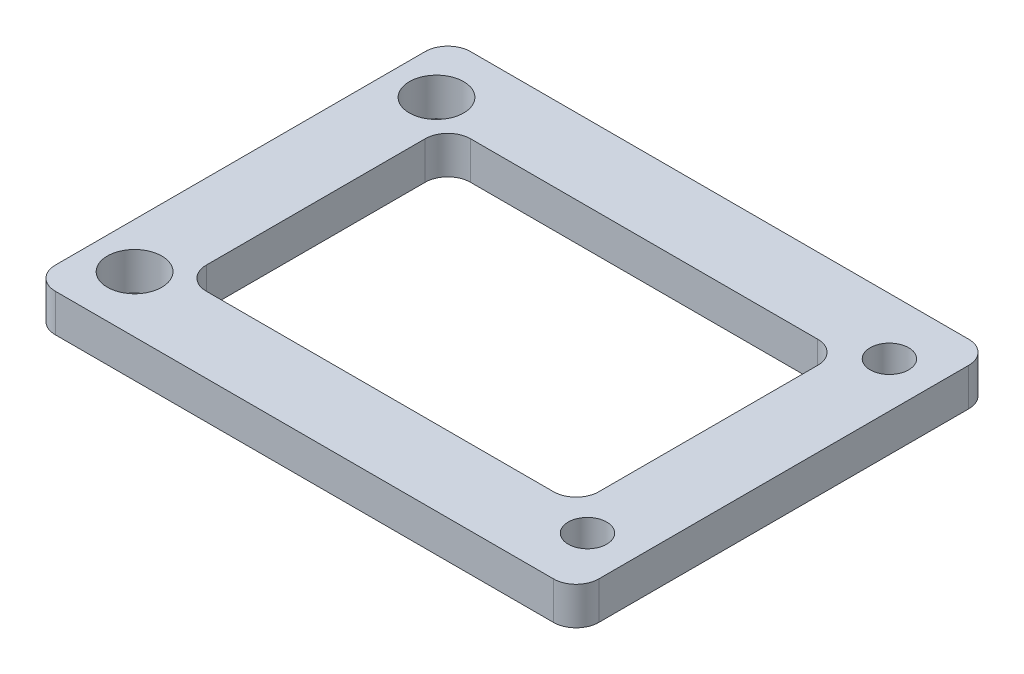
from build123d import *

# Parameters (mm, degrees)
SKETCH1_R                                  = 3.6
SKETCH1_R_2                                = 2.55
BOSS_EXTRUDE1_DEPTH                        = 5
SKETCH3_W                                  = 72
SKETCH3_H                                  = 55
SKETCH3_R                                  = 2.55
SKETCH3_R_2                                = 3.6
SKETCH3_W_2                                = 52
SKETCH3_H_2                                = 35
BOSS_EXTRUDE2_DEPTH                        = 5
SKETCH4_W                                  = 52
SKETCH4_H                                  = 35
CUT_EXTRUDE1_DEPTH                         = 5
MIRROR1_AT_THE_SECOND_PLANE_COPY_1_SKETC_W = 52
MIRROR1_AT_THE_SECOND_PLANE_COPY_1_SKETC_H = 35
MIRROR1_AT_THE_SECOND_PLANE_COPY_1_DEPTH   = 5
FILLET1_R                                  = 3


with BuildPart() as part:
    # Sketch1 → Boss-Extrude1 (new body)
    with BuildSketch(Plane(origin=(0, 0, 0), x_dir=(1, 0, 0), z_dir=(0, 1, 0))):
        with BuildLine():
            ThreePointArc((-26.117098626, 25.82435206), (-35.82435206, 23.882901374), (-33.882901374, 14.17564794))
            Line((-33.882901374, 14.17564794), (-12.619429464, 0))
            Line((-12.619429464, 0), (-33.882901374, -14.17564794))
            ThreePointArc((-33.882901374, -14.17564794), (-35.82435206, -23.882901374), (-26.117098626, -25.82435206))
            Line((-26.117098626, -25.82435206), (0, -8.412952976))
            Line((0, -8.412952976), (26.117098626, -25.82435206))
            ThreePointArc((26.117098626, -25.82435206), (35.82435206, -23.882901374), (33.882901374, -14.17564794))
            Line((33.882901374, -14.17564794), (12.619429464, 0))
            Line((12.619429464, 0), (33.882901374, 14.17564794))
            ThreePointArc((33.882901374, 14.17564794), (35.82435206, 23.882901374), (26.117098626, 25.82435206))
            Line((26.117098626, 25.82435206), (0, 8.412952976))
            Line((0, 8.412952976), (-26.117098626, 25.82435206))
        make_face()
        with Locations((-30, -20)):
            Circle(SKETCH1_R, mode=Mode.SUBTRACT)
        with Locations((30, -20)):
            Circle(SKETCH1_R_2, mode=Mode.SUBTRACT)
        with Locations((-30, 20)):
            Circle(SKETCH1_R, mode=Mode.SUBTRACT)
        with Locations((30, 20)):
            Circle(SKETCH1_R_2, mode=Mode.SUBTRACT)
    extrude(amount=BOSS_EXTRUDE1_DEPTH)

    # Sketch3 → Boss-Extrude2 (add)
    with BuildSketch(Plane.XZ):
        Rectangle(SKETCH3_W, SKETCH3_H)
        with Locations((30, 20)):
            Circle(SKETCH3_R, mode=Mode.SUBTRACT)
        with Locations((30, -20)):
            Circle(SKETCH3_R, mode=Mode.SUBTRACT)
        with Locations((-30, -20)):
            Circle(SKETCH3_R_2, mode=Mode.SUBTRACT)
        with Locations((-30, 20)):
            Circle(SKETCH3_R_2, mode=Mode.SUBTRACT)
        Rectangle(SKETCH3_W_2, SKETCH3_H_2, mode=Mode.SUBTRACT)
    extrude(amount=-BOSS_EXTRUDE2_DEPTH)

    # Sketch4 → Cut-Extrude1 (cut)
    with BuildSketch(Plane.XZ):
        Rectangle(SKETCH4_W, SKETCH4_H)
        with BuildLine():
            Line((-36, 23.605551275), (-36, 16.394448725))
            ThreePointArc((-36, 16.394448725), (-37, 20), (-36, 23.605551275))
        make_face()
    cut_extrude1 = extrude(amount=-CUT_EXTRUDE1_DEPTH, mode=Mode.SUBTRACT)

    # Mirror1: Cut-Extrude1 across plane
    add(cut_extrude1.mirror(Plane(origin=(0, 0, 0), x_dir=(0, 0, 1), z_dir=(1, 0, 0))), mode=Mode.SUBTRACT)

    # Mirror1 at the second plane: Cut-Extrude1 across plane
    add(cut_extrude1.mirror(Plane.XY), mode=Mode.SUBTRACT)

    # Mirror1 at the second plane copy 1 sketc → Mirror1 at the second plane copy 1 (cut)
    with BuildSketch(Plane(origin=(0, 0, 0), x_dir=(-1, 0, 0), z_dir=(0, -1, 0))):
        Rectangle(MIRROR1_AT_THE_SECOND_PLANE_COPY_1_SKETC_W, MIRROR1_AT_THE_SECOND_PLANE_COPY_1_SKETC_H)
        with BuildLine():
            Line((-36, 23.605551275), (-36, 16.394448725))
            ThreePointArc((-36, 16.394448725), (-37, 20), (-36, 23.605551275))
        make_face()
    extrude(amount=-MIRROR1_AT_THE_SECOND_PLANE_COPY_1_DEPTH, mode=Mode.SUBTRACT)

    # Fillet1
    fillet1_edges = [part.edges().sort_by_distance(p)[0] for p in [
        (26, 2.5, 17.5),
        (-26, 2.5, 17.5),
        (26, 2.5, -17.5),
        (-26, 2.5, -17.5),
        (-36, 2.5, -27.5),
        (36, 2.5, -27.5),
        (36, 2.5, 27.5),
        (-36, 2.5, 27.5),
    ]]
    fillet(fillet1_edges, radius=FILLET1_R)


solid = part.part
